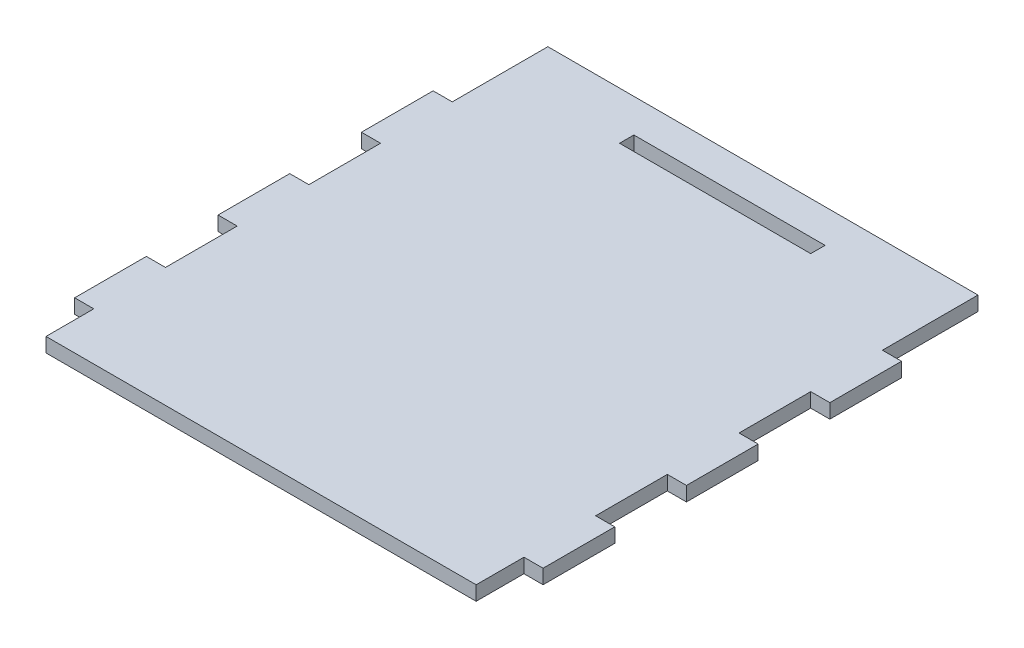
from build123d import *

# Parameters (mm, degrees)
SKETCH1_W           = 90
SKETCH1_H           = 47.5
BOSS_EXTRUDE1_DEPTH = 3
SKETCH4_W           = 4
SKETCH4_H           = 15
BOSS_EXTRUDE4_DEPTH = 3
SKETCH5_W           = 90
SKETCH5_H           = 10
BOSS_EXTRUDE5_DEPTH = 3
SKETCH6_W           = 40
SKETCH6_H           = 3
CUT_EXTRUDE2_DEPTH  = 4


with BuildPart() as part:
    # Sketch1 → Boss-Extrude1 (new body)
    with BuildSketch(Plane(origin=(0, 0, 0), x_dir=(1, 0, 0), z_dir=(0, 1, 0))):
        with Locations((45, 23.75)):
            Rectangle(SKETCH1_W, SKETCH1_H)
        with Locations((45, 23.75)):
            Rectangle(SKETCH1_W, SKETCH1_H)
        with Locations((45, 71.25)):
            Rectangle(SKETCH1_W, SKETCH1_H)
        with Locations((45, 71.25)):
            Rectangle(SKETCH1_W, SKETCH1_H)
        with Locations((45, 71.25)):
            Rectangle(SKETCH1_W, SKETCH1_H)
        with Locations((45, 23.75)):
            Rectangle(SKETCH1_W, SKETCH1_H)
    extrude(amount=BOSS_EXTRUDE1_DEPTH)

    # Sketch4 → Boss-Extrude4 (add)
    with BuildSketch(Plane(origin=(0, 3, 0), x_dir=(1, 0, 0), z_dir=(0, 1, 0))):
        with Locations((-2, 77.5)):
            Rectangle(SKETCH4_W, SKETCH4_H)
        with Locations((-2, 47.5)):
            Rectangle(SKETCH4_W, SKETCH4_H)
        with Locations((-2, 17.5)):
            Rectangle(SKETCH4_W, SKETCH4_H)
        with Locations((92, 77.5)):
            Rectangle(SKETCH4_W, SKETCH4_H)
        with Locations((92, 47.5)):
            Rectangle(SKETCH4_W, SKETCH4_H)
        with Locations((92, 17.5)):
            Rectangle(SKETCH4_W, SKETCH4_H)
    extrude(amount=-BOSS_EXTRUDE4_DEPTH)

    # Sketch5 → Boss-Extrude5 (add)
    with BuildSketch(Plane(origin=(0, 3, 0), x_dir=(1, 0, 0), z_dir=(0, 1, 0))):
        with Locations((45, 100)):
            Rectangle(SKETCH5_W, SKETCH5_H)
    extrude(amount=-BOSS_EXTRUDE5_DEPTH)

    # Sketch6 → Cut-Extrude2 (cut)
    with BuildSketch(Plane(origin=(0, 3, 0), x_dir=(1, 0, 0), z_dir=(0, 1, 0))):
        with Locations((45, 96.5)):
            Rectangle(SKETCH6_W, SKETCH6_H)
    extrude(amount=-CUT_EXTRUDE2_DEPTH, mode=Mode.SUBTRACT)


solid = part.part
